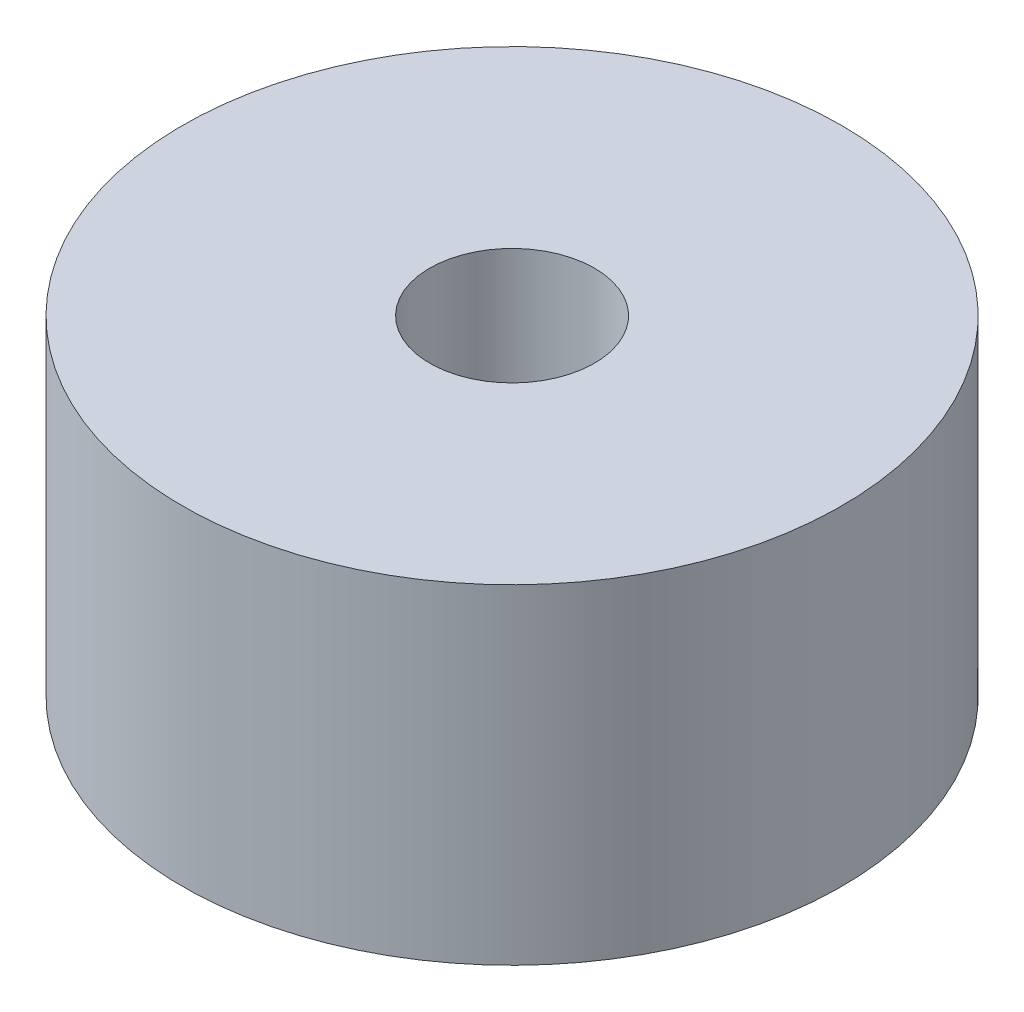
from build123d import *

# Parameters (mm, degrees)
SKETCH2_R           = 19.05
SKETCH2_R_2         = 4.7625
BOSS_EXTRUDE1_DEPTH = 19.05


with BuildPart() as part:
    # Sketch2 → Boss-Extrude1 (new body)
    with BuildSketch(Plane(origin=(0, 0, 0), x_dir=(1, 0, 0), z_dir=(0, 1, 0))):
        Circle(SKETCH2_R)
        Circle(SKETCH2_R_2, mode=Mode.SUBTRACT)
    extrude(amount=BOSS_EXTRUDE1_DEPTH)


solid = part.part
